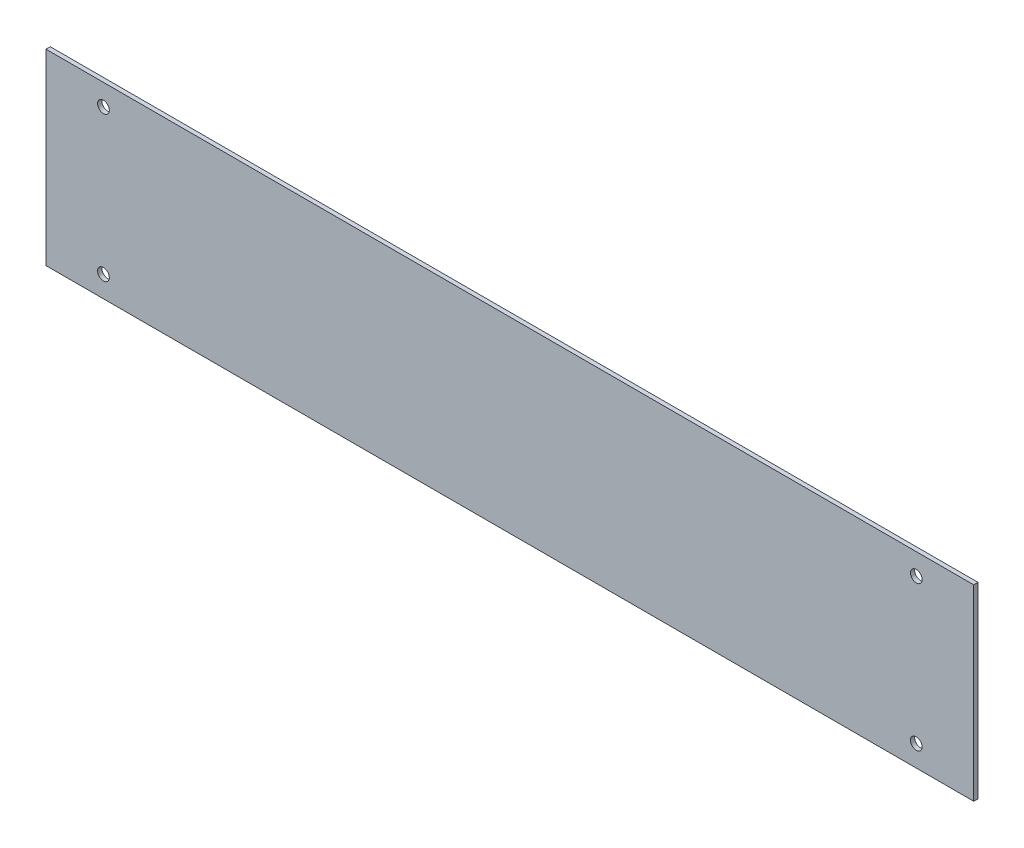
from build123d import *

# Parameters (mm, degrees)
SKETCH_1_W          = 436
SKETCH_1_H          = 88.1
EXTRUDE_1_DEPTH     = 2
SKETCH_6_R          = 2.75
CUT_EXTRUDE_1_DEPTH = 445.816377846


with BuildPart() as part:
    # Эскиз1 → Бобышка-Вытянуть1 (new body)
    with BuildSketch(Plane.XY):
        with Locations((218, 44.05)):
            Rectangle(SKETCH_1_W, SKETCH_1_H)
    extrude(amount=EXTRUDE_1_DEPTH)

    # Эскиз6 → Вырез-Вытянуть1 (cut, through all)
    with BuildSketch(Plane(origin=(0, 0, 0), x_dir=(-1, 0, 0), z_dir=(0, 0, -1))):
        with Locations((-409, 78.1)):
            Circle(SKETCH_6_R)
        with Locations((-409, 10)):
            Circle(SKETCH_6_R)
        with Locations((-27, 10)):
            Circle(SKETCH_6_R)
        with Locations((-27, 78.1)):
            Circle(SKETCH_6_R)
    extrude(amount=-CUT_EXTRUDE_1_DEPTH, mode=Mode.SUBTRACT)


solid = part.part
